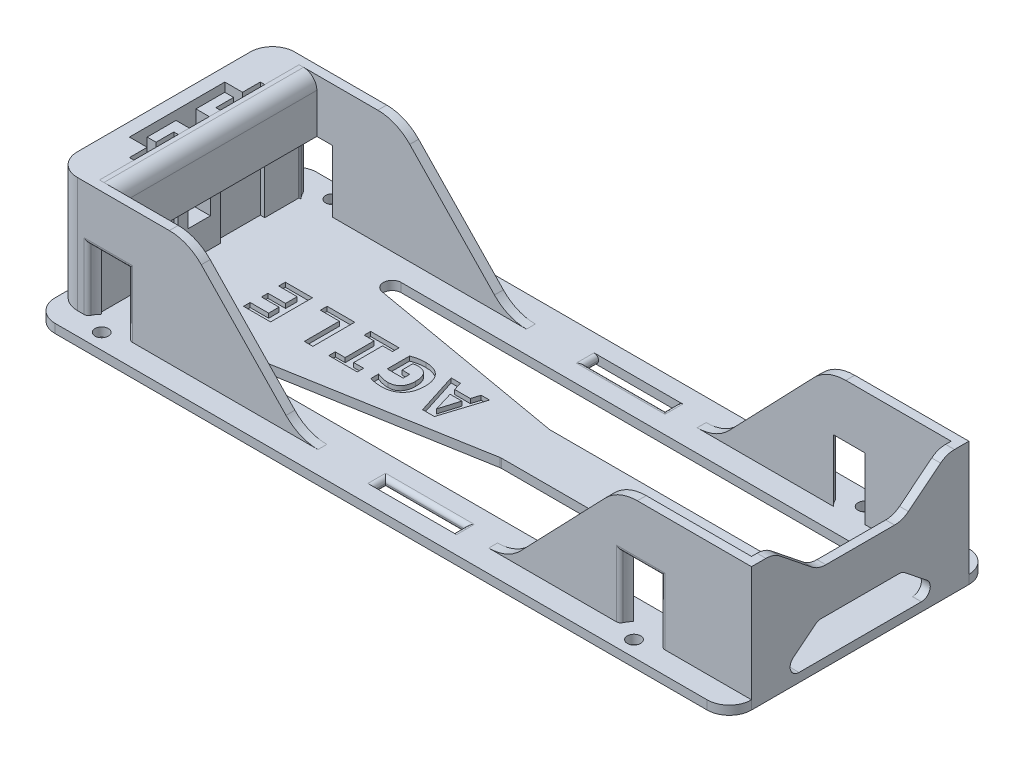
from build123d import *
from build123d.topology import SkipClean

# Parameters (mm, degrees)
SKETCH_1_W            = 157
SKETCH_1_H            = 49
SKETCH_1_W_2          = 147
SKETCH_1_H_2          = 45
EXTRUDE_1_DEPTH       = 26
SKETCH_2_W            = 157
SKETCH_2_H            = 49
EXTRUDE_2_DEPTH       = 2
CUT_EXTRUDE_1_DEPTH   = 10
SKETCH_5_W            = 1
SKETCH_5_H            = 10
CUT_EXTRUDE_2_DEPTH   = 16
SKETCH_6_W            = 5
SKETCH_6_H            = 11
CUT_EXTRUDE_3_DEPTH   = 8
EXTRUDE_START         = -29.740449111
EXTRUDE_5_OUTLINE_W   = 157
EXTRUDE_5_OUTLINE_H   = 2
EXTRUDE_5_DEPTH       = 1.9999999
EXTRUDE_START_2       = 27.259550989
EXTRUDE_5_2_OUTLINE_W = 157
EXTRUDE_5_2_OUTLINE_H = 2
EXTRUDE_5_2_DEPTH     = 1.9999999
EXTRUDE_START_3       = -2
EXTRUDE_5_3_DEPTH     = 2
EXTRUDE_9_DEPTH       = 12
SKETCH_8_R            = 5
CUT_EXTRUDE_4_DEPTH   = 14
CUT_EXTRUDE_5_DEPTH   = 49
FILLET_5_R            = 10
FILLET_6_R            = 5
FILLET_7_R            = 5
CUT_EXTRUDE_6_DEPTH   = 2
FILLET_8_R            = 5
FILLET_10_R           = 1
FILLET_11_R           = 1
SKETCH_20_W           = 18
SKETCH_20_H           = 3
CUT_EXTRUDE_8_DEPTH   = 2
FILLET_13_R           = 3
FILLET_14_R           = 1
CUT_EXTRUDE_9_DEPTH   = 2
FILLET_16_R           = 2
CUT_EXTRUDE_10_DEPTH  = 1
FILLET_18_R           = 2


with BuildPart() as part:
    # Эскиз1 → Бобышка-Вытянуть1 (new body)
    with BuildSketch(Plane(origin=(0, 0, 0), x_dir=(1, 0, 0), z_dir=(0, 1, 0))):
        with Locations((-8.169311287, 0.240449111)):
            Rectangle(SKETCH_1_W, SKETCH_1_H)
        with Locations((-5.169311287, 0.240449111)):
            Rectangle(SKETCH_1_W_2, SKETCH_1_H_2, mode=Mode.SUBTRACT)
    extrude(amount=EXTRUDE_1_DEPTH)

    # Эскиз2 → Бобышка-Вытянуть2 (add)
    with BuildSketch(Plane.XZ):
        with Locations((-8.169311287, -0.240449111)):
            Rectangle(SKETCH_2_W, SKETCH_2_H)
    extrude(amount=EXTRUDE_2_DEPTH)

    # Эскиз4 → Вырез-Вытянуть1 (cut)
    with BuildSketch(Plane(origin=(0, 26, 0), x_dir=(1, 0, 0), z_dir=(0, 1, 0))):
        Polygon((-78.669311287, -4.509550889), (-78.669311287, -14.509550889), (-79.669311287, -14.509550889), (-79.669311287, -10.509550889), (-83.669311287, -10.509550889), (-83.669311287, 10.990449111), (-79.669311287, 10.990449111), (-79.669311287, 14.990449111), (-78.669311287, 14.990449111), (-78.669311287, 4.990449111), (-79.669311287, 4.990449111), (-79.669311287, 8.990449111), (-81.669311287, 8.990449111), (-81.669311287, 2.490449111), (-78.669311287, 2.490449111), (-78.669311287, 0.240449111), (-78.669311287, -2.009550889), (-81.669311287, -2.009550889), (-81.669311287, -8.509550889), (-79.669311287, -8.509550889), (-79.669311287, -4.509550889), align=None)
    extrude(amount=-CUT_EXTRUDE_1_DEPTH, mode=Mode.SUBTRACT)

    # Эскиз5 → Вырез-Вытянуть2 (cut)
    with BuildSketch(Plane(origin=(0, 16, 0), x_dir=(1, 0, 0), z_dir=(0, 1, 0))):
        with Locations((-79.169311287, -9.509550889)):
            Rectangle(SKETCH_5_W, SKETCH_5_H)
        with Locations((-79.169311287, 9.990449111)):
            Rectangle(SKETCH_5_W, SKETCH_5_H)
    extrude(amount=-CUT_EXTRUDE_2_DEPTH, mode=Mode.SUBTRACT)

    # Эскиз6 → Вырез-Вытянуть3 (cut)
    with BuildSketch(Plane.ZY.offset(86.669311287)):
        with Locations((-0.240449111, 12)):
            Rectangle(SKETCH_6_W, SKETCH_6_H)
    extrude(amount=-CUT_EXTRUDE_3_DEPTH, mode=Mode.SUBTRACT)



with BuildPart() as body_2:
    # Бобышка-Вытянуть5: read off the stored shape, not the designer's step
    # Бобышка-Вытянуть5 outline → Бобышка-Вытянуть5 (new body)
    with BuildSketch(Plane.XY.offset(EXTRUDE_START)):
        with Locations((-8.169311287, -1)):
            Rectangle(EXTRUDE_5_OUTLINE_W, EXTRUDE_5_OUTLINE_H)
    extrude(amount=EXTRUDE_5_DEPTH)


with BuildPart() as body_3:
    # Extrude 5 2 outline → Extrude 5 2 (new body)
    with BuildSketch(Plane.XY.offset(EXTRUDE_START_2)):
        with Locations((-8.169311287, -1)):
            Rectangle(EXTRUDE_5_2_OUTLINE_W, EXTRUDE_5_2_OUTLINE_H)
    extrude(amount=EXTRUDE_5_2_DEPTH)


with BuildPart() as part_1:
    with SkipClean():  # the faces are left unmerged after this step: merging them gives an invalid solid
        add(part.part)

        add(body_2.part)  # Extrude 5 3 merges body 2

        add(body_3.part)  # Extrude 5 3 merges body 3
        # Extrude 5 3 outline → Extrude 5 3 (add)
        with BuildSketch(Plane(origin=(0, 0, 0), x_dir=(1, 0, 0), z_dir=(0, 1, 0)).offset(EXTRUDE_START_3)):
            with BuildLine():
                ThreePointArc((45.330688713, -24.259550889), (46.830688713, -25.759550916), (45.330688659, -27.259550889))
                Line((45.330688659, -27.259550889), (70.330688713, -27.259550989))
                Line((70.330688713, -27.259550989), (70.330688713, -24.259550889))
                Line((70.330688713, -24.259550889), (45.330688713, -24.259550889))
            make_face()
            with BuildLine():
                ThreePointArc((45.330688659, -27.259550889), (43.830688713, -25.759550862), (45.330688713, -24.259550889))
                Line((45.330688713, -24.259550889), (-74.66931127, -24.259550889))
                ThreePointArc((-74.66931127, -24.259550889), (-73.169311287, -25.759550897), (-74.669311287, -27.259550889))
                Line((-74.669311287, -27.259550889), (45.330688659, -27.259550889))
            make_face()
            with BuildLine():
                ThreePointArc((-74.669311287, -27.259550889), (-76.169311287, -25.759550881), (-74.66931127, -24.259550889))
                Line((-74.66931127, -24.259550889), (-86.669311287, -24.259550889))
                Line((-86.669311287, -24.259550889), (-86.669311287, -27.259550989))
                Line((-86.669311287, -27.259550989), (-74.669311287, -27.259550889))
            make_face()
            with BuildLine():
                Line((45.33068874, 24.740449111), (70.330688713, 24.740449111))
                Line((70.330688713, 24.740449111), (70.330688713, 27.740449211))
                Line((70.330688713, 27.740449211), (45.330688767, 27.740449111))
                ThreePointArc((45.330688767, 27.740449111), (46.830688713, 26.240449097), (45.33068874, 24.740449111))
            make_face()
            with BuildLine():
                Line((-74.669311287, 24.740449111), (45.33068874, 24.740449111))
                ThreePointArc((45.33068874, 24.740449111), (43.830688713, 26.240449125), (45.330688767, 27.740449111))
                Line((45.330688767, 27.740449111), (-74.669311287, 27.740449111))
                ThreePointArc((-74.669311287, 27.740449111), (-73.169311287, 26.240449111), (-74.669311287, 24.740449111))
            make_face()
            with BuildLine():
                Line((-86.669311287, 27.740449211), (-86.669311287, 24.740449111))
                Line((-86.669311287, 24.740449111), (-74.669311287, 24.740449111))
                ThreePointArc((-74.669311287, 24.740449111), (-76.169311287, 26.240449111), (-74.669311287, 27.740449111))
                Line((-74.669311287, 27.740449111), (-86.669311287, 27.740449211))
            make_face()
        extrude(amount=EXTRUDE_5_3_DEPTH)

    # Эскиз8 → Вырез-Вытянуть4 (cut)
    with BuildSketch(Plane(origin=(0, 0, 0), x_dir=(1, 0, 0), z_dir=(0, 1, 0))):
        with Locations((45.330688713, 26.240449111)):
            Circle(SKETCH_8_R)
        with Locations((-74.669311287, 26.240449111)):
            Circle(SKETCH_8_R)
        with Locations((-74.669311287, -25.759550889)):
            Circle(SKETCH_8_R)
        with Locations((45.330688713, -25.759550889)):
            Circle(SKETCH_8_R)
    extrude(amount=CUT_EXTRUDE_4_DEPTH, mode=Mode.SUBTRACT)

    # Эскиз17 → Вырез-Вытянуть5 (cut)
    with BuildSketch(Plane(origin=(0, 0, -24.740449111), x_dir=(-1, 0, 0), z_dir=(0, 0, -1))):
        Polygon((-40.330688713, 26), (-15.330688713, 0), (31.669311287, 0), (56.669311287, 26), align=None)
    extrude(amount=-CUT_EXTRUDE_5_DEPTH, mode=Mode.SUBTRACT)

    # Скругление5
    fillet_5_edges = [part_1.edges().sort_by_distance(p)[0] for p in [
        (40.330688713, 26, 23.259550889),
        (-31.669311287, 0, 23.259550889),
        (-56.669311287, 26, 23.259550889),
        (15.330688713, 0, 23.259550889),
        (40.330688713, 26, -23.740449111),
        (-56.669311287, 26, -23.740449111),
        (-31.669311287, 0, -23.740449111),
        (15.330688713, 0, -23.740449111),
    ]]
    fillet(fillet_5_edges, radius=FILLET_5_R)

    # Скругление6
    fillet_6_edges = [part_1.edges().sort_by_distance(p)[0] for p in [
        (-86.669311287, 13, 24.259550889),
        (-86.669311287, 13, -24.740449111),
    ]]
    fillet(fillet_6_edges, radius=FILLET_6_R)

    # Скругление7
    fillet_7_edges = [part_1.edges().sort_by_distance(p)[0] for p in [
        (-86.669311287, -1, 29.259550889),
        (-86.669311287, -1, -29.740449111),
        (70.330688713, -1, -29.740449111),
        (70.330688713, -1, 29.259550889),
    ]]
    fillet(fillet_7_edges, radius=FILLET_7_R)

    # Эскиз19 → Вырез-Вытянуть6 (cut)
    with BuildSketch(Plane(origin=(70.330688713, 0, 0), x_dir=(0, 0, -1), z_dir=(1, 0, 0))):
        Polygon((-19.259550889, 26), (19.740449111, 26), (9.740449111, 18), (-9.259550889, 18), align=None)
        Polygon((-19.259550889, 0), (19.740449111, 0), (9.740449111, 8), (-9.259550889, 8), align=None)
    extrude(amount=-CUT_EXTRUDE_6_DEPTH, mode=Mode.SUBTRACT)

    # Скругление8
    fillet_8_edges = [part_1.edges().sort_by_distance(p)[0] for p in [
        (69.330688713, 18, 9.259550889),
        (69.330688713, 26, 19.259550889),
        (69.330688713, 26, -19.740449111),
        (69.330688713, 18, -9.740449111),
    ]]
    fillet(fillet_8_edges, radius=FILLET_8_R)

    # Скругление10
    fillet_10_edges = [part_1.edges().sort_by_distance(p)[0] for p in [
        (45.330688713, 14, 24.259550889),
        (-74.669311287, 14, 24.259550889),
        (-74.669311287, 14, -24.740449111),
        (45.330688713, 14, -24.740449111),
    ]]
    fillet(fillet_10_edges, radius=FILLET_10_R)

    # Скругление11
    fillet_11_edges = [part_1.edges().sort_by_distance(p)[0] for p in [
        (40.560992706, 7.5, -24.740449111),
        (50.10038472, 7.5, -24.740449111),
        (-79.439007294, 7.5, -24.740449111),
        (-69.89961528, 7.5, -24.740449111),
        (-69.89961528, 7.5, 24.259550889),
        (-79.439007294, 7.5, 24.259550889),
        (50.10038472, 7.5, 24.259550889),
        (40.560992706, 7.5, 24.259550889),
    ]]
    fillet(fillet_11_edges, radius=FILLET_11_R)

    # Эскиз20 → Вырез-Вытянуть8 (cut)
    with BuildSketch(Plane(origin=(0, 0, 0), x_dir=(1, 0, 0), z_dir=(0, 1, 0))):
        with Locations((-5.169311287, 24.240449111)):
            Rectangle(SKETCH_20_W, SKETCH_20_H)
        with Locations((-5.169311287, -23.759550889)):
            Rectangle(SKETCH_20_W, SKETCH_20_H)
    extrude(amount=-CUT_EXTRUDE_8_DEPTH, mode=Mode.SUBTRACT)

    # Скругление14
    fillet_14_edges = [part_1.edges().sort_by_distance(p)[0] for p in [
        (3.830688713, 0, -24.240449111),
        (3.830688713, -2, -24.240449111),
        (-14.169311287, 0, -24.240449111),
        (-14.169311287, -2, -24.240449111),
        (-5.169311287, 0, -22.740449111),
        (-5.169311287, -2, -22.740449111),
        (3.830688713, 0, 23.759550889),
        (3.830688713, -2, 23.759550889),
        (-14.169311287, 0, 23.759550889),
        (-14.169311287, -2, 23.759550889),
        (-5.169311287, 0, 22.259550889),
        (-5.169311287, -2, 22.259550889),
    ]]
    fillet(fillet_14_edges, radius=FILLET_14_R - 0.0001)  # a hair under: the kernel refuses the full size

    # Эскиз21 → Вырез-Вытянуть9 (cut)
    with BuildSketch(Plane(origin=(0, 0, 0), x_dir=(1, 0, 0), z_dir=(0, 1, 0))):
        Polygon((48.330688713, 5.740449111), (-5.169311287, 5.740449111), (-73.669311287, 17.740449111), (63.330688713, 17.740449111), align=None)
        Polygon((48.330688713, -5.259550889), (-5.169311287, -5.259550889), (-73.669311287, -17.259550889), (63.330688713, -17.259550889), align=None)
    extrude(amount=-CUT_EXTRUDE_9_DEPTH, mode=Mode.SUBTRACT)

    # Скругление16
    fillet_16_edges = [part_1.edges().sort_by_distance(p)[0] for p in [
        (-5.169311287, -1, -5.740449111),
        (-73.669311287, -1, -17.740449111),
        (63.330688713, -1, -17.740449111),
        (48.330688713, -1, -5.740449111),
        (-73.669311287, -1, 17.259550889),
        (-5.169311287, -1, 5.259550889),
        (48.330688713, -1, 5.259550889),
        (63.330688713, -1, 17.259550889),
    ]]
    fillet(fillet_16_edges, radius=FILLET_16_R)

    # Эскиз22 → Вырез-Вытянуть10 (cut)
    # profile 1 of 5: a face of its own
    with BuildSketch(Plane(origin=(0, 0, 0), x_dir=(1, 0, 0), z_dir=(0, 1, 0))):
        Polygon((-57.663267679, 4.740449111), (-57.663267679, -4.691533311), (-63.763799497, -4.691533311), (-63.763799497, -3.190456081), (-59.600555385, -3.190456081), (-59.600555385, -0.844755624), (-63.569215412, -0.844755624), (-63.569215412, 0.619970733), (-59.600555385, 0.619970733), (-59.600555385, 3.239371882), (-63.763799497, 3.239371882), (-63.763799497, 4.740449111), align=None)
    # profile 2 of 5: a face of its own
    with BuildSketch(Plane(origin=(0, 0, 0), x_dir=(1, 0, 0), z_dir=(0, 1, 0))):
        Polygon((-48.129502812, 4.740449111), (-48.129502812, -4.691533311), (-50.066790519, -4.691533311), (-50.066790519, 3.217989015), (-54.34550211, 3.217989015), (-54.34550211, 4.740449111), align=None)
    # profile 3 of 5: a face of its own
    with BuildSketch(Plane(origin=(0, 0, 0), x_dir=(1, 0, 0), z_dir=(0, 1, 0))):
        Polygon((-38.131729742, -3.241774961), (-38.131729742, -4.691533311), (-44.533759978, -4.691533311), (-44.533759978, -3.241774961), (-42.301388714, -3.241774961), (-42.301388714, 3.275722755), (-44.533759978, 3.275722755), (-44.533759978, 4.740449111), (-38.131729742, 4.740449111), (-38.131729742, 3.275722755), (-40.364101007, 3.275722755), (-40.364101007, -3.241774961), align=None)
    # profile 4 of 5: a face of its own
    with BuildSketch(Plane(origin=(0, 0, 0), x_dir=(1, 0, 0), z_dir=(0, 1, 0))):
        with BuildLine():
            Line((-31.745522827, 0.750406219), (-31.745522827, -0.716458425))
            Line((-31.745522827, -0.716458425), (-35.348535836, -0.716458425))
            Line((-35.348535836, -0.716458425), (-35.348535836, 4.314930067))
            add(Edge.make_bspline(
                [(-35.348535836, 4.314930067), (-35.231441126, 4.363314243), (-34.997452097, 4.459999791), (-34.636599846, 4.581145908), (-34.268694962, 4.684987727), (-33.890458692, 4.764865839), (-33.500468807, 4.830857442), (-33.095526426, 4.873615094), (-32.673982898, 4.903306091), (-32.387776811, 4.905907087), (-32.241605331, 4.90723547)],
                knots=[0, 0, 0, 0, 0.954252201, 1.906871339, 2.865750481, 3.832595216, 4.817771023, 5.844227278, 6.899001442, 8, 8, 8, 8], degree=3))
            add(Edge.make_bspline(
                [(-32.241605331, 4.90723547), (-32.070409105, 4.903434706), (-31.735637393, 4.896002367), (-31.246533517, 4.841079675), (-30.784684965, 4.743806263), (-30.348485689, 4.612578839), (-29.942466239, 4.441380119), (-29.564982112, 4.235505004), (-29.222801953, 3.987874001), (-28.909998928, 3.706207316), (-28.629887752, 3.387579503), (-28.385850408, 3.031124442), (-28.17836983, 2.63780609), (-28.00167863, 2.211215241), (-27.865966675, 1.747195746), (-27.768579618, 1.248373471), (-27.707412816, 0.714862124), (-27.701028579, 0.347153899), (-27.697746195, 0.158100816)],
                knots=[0, 0, 0, 0, 1.099092493, 2.149259278, 3.154491752, 4.125850618, 5.06928634, 5.978722912, 6.880446818, 7.77471944, 8.676199446, 9.59776024, 10.541562165, 11.526537976, 12.557504186, 13.639882499, 14.786571906, 16, 16, 16, 16], degree=3))
            add(Edge.make_bspline(
                [(-27.697746195, 0.158100816), (-27.701743329, -0.033105017), (-27.709535944, -0.405870448), (-27.773380334, -0.950028322), (-27.873695335, -1.464459482), (-28.01959982, -1.946838293), (-28.203872784, -2.395725019), (-28.423823665, -2.811217684), (-28.683948825, -3.190341871), (-28.983151038, -3.531889211), (-29.318108243, -3.837873466), (-29.6912539, -4.103072572), (-30.097643665, -4.334720964), (-30.542536342, -4.521508645), (-31.020225172, -4.669217574), (-31.53097903, -4.772576209), (-32.07309631, -4.838452401), (-32.445969574, -4.845931204), (-32.637188361, -4.849766523)],
                knots=[0, 0, 0, 0, 1.148395122, 2.238854302, 3.286905103, 4.293411718, 5.261170483, 6.197937726, 7.112509477, 8.016849162, 8.920154192, 9.831592945, 10.761602393, 11.724765057, 12.724334168, 13.760649765, 14.851604878, 16, 16, 16, 16], degree=3))
            add(Edge.make_bspline(
                [(-32.637188361, -4.849766523), (-32.866983369, -4.844701327), (-33.322402214, -4.834662877), (-33.997387102, -4.745766382), (-34.662383405, -4.614894692), (-35.098948411, -4.49801954), (-35.318599823, -4.439215486)],
                knots=[0, 0, 0, 0, 1.01294372, 2.007500786, 2.997502638, 4, 4, 4, 4], degree=3))
            Line((-35.318599823, -4.439215486), (-35.318599823, -2.685820431))
            add(Edge.make_bspline(
                [(-35.318599823, -2.685820431), (-35.220596963, -2.726646056), (-35.022067619, -2.809348586), (-34.712301422, -2.918466911), (-34.388072246, -3.015647992), (-34.051412302, -3.104600626), (-33.705776566, -3.173896365), (-33.356222966, -3.226165049), (-33.00479729, -3.256397796), (-32.76981721, -3.260902301), (-32.652156368, -3.263157827)],
                knots=[0, 0, 0, 0, 0.927569041, 1.879023459, 2.868118478, 3.884772859, 4.920572748, 5.946721678, 6.971868353, 8, 8, 8, 8], degree=3))
            add(Edge.make_bspline(
                [(-32.652156368, -3.263157827), (-32.536555544, -3.260263256), (-32.311656837, -3.254631934), (-31.984188132, -3.211508918), (-31.678084801, -3.139519817), (-31.392706427, -3.038249684), (-31.129695671, -2.910095067), (-30.888326852, -2.756949422), (-30.667882229, -2.581419626), (-30.473006589, -2.377973917), (-30.297779276, -2.15248794), (-30.148707991, -1.900085959), (-30.020235025, -1.625001534), (-29.913023704, -1.326670914), (-29.830889761, -1.005791227), (-29.770475407, -0.664213296), (-29.737365822, -0.302998109), (-29.73190616, -0.055790499), (-29.729118515, 0.070431063)],
                knots=[0, 0, 0, 0, 1.101634635, 2.143204484, 3.141811576, 4.093754355, 5.023522806, 5.924447927, 6.813589339, 7.70244519, 8.603395928, 9.529682832, 10.490097361, 11.493683918, 12.546646776, 13.643494593, 14.796793536, 16, 16, 16, 16], degree=3))
            add(Edge.make_bspline(
                [(-29.729118515, 0.070431063), (-29.730550938, 0.192364083), (-29.733352733, 0.430862834), (-29.76131057, 0.779404974), (-29.808613067, 1.109141439), (-29.871259522, 1.420642321), (-29.956285006, 1.711389981), (-30.062535965, 1.980899627), (-30.194195374, 2.226709973), (-30.348107838, 2.450807571), (-30.527230948, 2.650079253), (-30.726481119, 2.828744464), (-30.954508149, 2.975638289), (-31.204216344, 3.101095481), (-31.480525932, 3.199623067), (-31.784553159, 3.270126159), (-32.116559356, 3.309358615), (-32.346993238, 3.315377025), (-32.466125429, 3.318488488)],
                knots=[0, 0, 0, 0, 1.20112951, 2.349387301, 3.441789648, 4.481577508, 5.47705112, 6.42244753, 7.330381181, 8.218630601, 9.093961985, 9.964633337, 10.846922593, 11.757649016, 12.71277532, 13.729665742, 14.826258128, 16, 16, 16, 16], degree=3))
            add(Edge.make_bspline(
                [(-32.466125429, 3.318488488), (-32.521739574, 3.318390854), (-32.625205969, 3.318209213), (-32.770679565, 3.308955979), (-32.901377869, 3.296461012), (-33.021851654, 3.276960292), (-33.136115631, 3.253772903), (-33.244672961, 3.224450313), (-33.353882925, 3.194313069), (-33.42698334, 3.17184794), (-33.464705296, 3.160255275)],
                knots=[0, 0, 0, 0, 1.313202027, 2.443124511, 3.44148512, 4.412941645, 5.324186445, 6.193898601, 7.067998755, 8, 8, 8, 8], degree=3))
            Line((-33.464705296, 3.160255275), (-33.464705296, 0.750406219))
            Line((-33.464705296, 0.750406219), (-31.745522827, 0.750406219))
        make_face()
    # profile 5 of 5: a face of its own
    with BuildSketch(Plane(origin=(0, 0, 0), x_dir=(1, 0, 0), z_dir=(0, 1, 0))):
        Polygon((-24.2880343, 4.740449111), (-23.729941484, 2.878001437), (-20.195353648, 2.878001437), (-19.622292825, 4.740449111), (-17.732047425, 4.740449111), (-20.729925311, -4.691533311), (-23.396368766, -4.691533311), (-26.396384939, 4.740449111), align=None)
        Polygon((-21.987237863, -2.959521123), (-20.652946992, 1.428243087), (-23.30442244, 1.428243087), align=None, mode=Mode.SUBTRACT)
    extrude(amount=-CUT_EXTRUDE_10_DEPTH, mode=Mode.SUBTRACT)

    # Скругление18
    fillet_18_edges = [part_1.edges().sort_by_distance(p)[0] for p in [
        (69.330688713, 0, 19.259550889),
        (69.330688713, 8, 9.259550889),
        (69.330688713, 8, -9.740449111),
        (69.330688713, 0, -19.740449111),
    ]]
    fillet(fillet_18_edges, radius=FILLET_18_R)


with BuildPart() as body_2_2:
    # Эскиз16 → Бобышка-Вытянуть9 (new body)
    with BuildSketch(Plane(origin=(0, 26, 0), x_dir=(1, 0, 0), z_dir=(0, 1, 0))):
        Polygon((-78.669311287, -22.259550889), (-74.669311287, -22.259550889), (-74.669311287, 22.740449111), (-78.669311287, 22.740449111), (-78.669311287, 14.990449111), (-78.669311287, 4.990449111), (-78.669311287, 2.490449111), (-78.669311287, -2.009550889), (-78.669311287, -4.509550889), (-78.669311287, -14.509550889), align=None)
    extrude(amount=-EXTRUDE_9_DEPTH)

    # Скругление13
    fillet_13_edges = [body_2_2.edges().sort_by_distance(p)[0] for p in [
        (-74.669311287, 26, -0.240449111),
    ]]
    fillet(fillet_13_edges, radius=FILLET_13_R)


solid = Compound([part_1.part, body_2_2.part])
